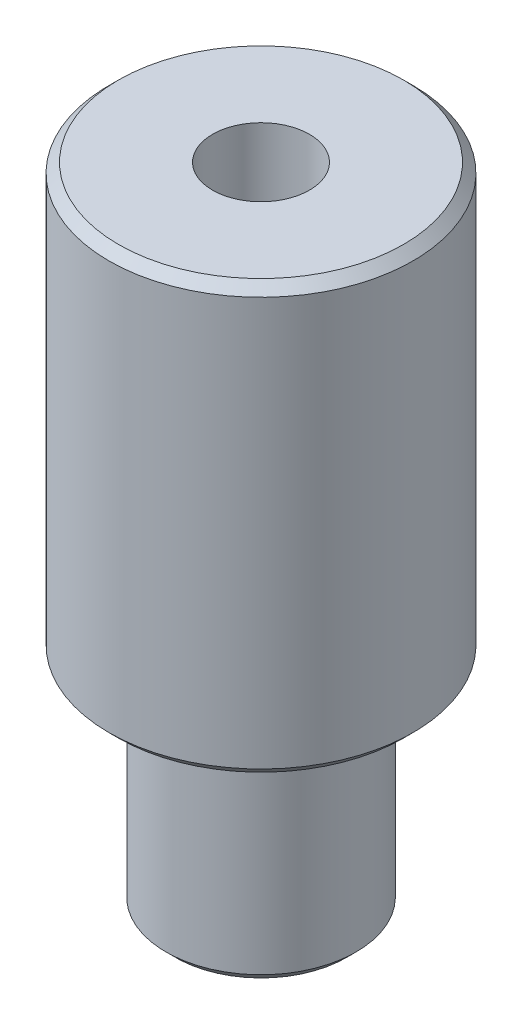
from build123d import *

# Parameters (mm, degrees)
CHAMFER1_SIZE                = 1
F_10_2_10_2_DIAMETER_HOLE1_D = 10.2


with BuildPart() as part:
    # Sketch1 → Revolve1 (revolve)
    with BuildSketch(Plane.XY):
        Polygon((0, 0), (16, 0), (16, -45), (10, -45), (10, -68), (0, -68), align=None)
    revolve(axis=Axis((0, -73, 0), (0, 1, 0)))

    # Chamfer1
    chamfer1_edges = [part.edges().sort_by_distance(p)[0] for p in [
        (-10, -68, 0),
        (-16, -45, 0),
        (-16, 0, 0),
    ]]
    chamfer(chamfer1_edges, length=CHAMFER1_SIZE)

    # Ø10.2 (10.2) Diameter Hole1 (through all)
    with Locations(Plane(origin=(0, 0, 0), x_dir=(1, 0, 0), z_dir=(0, 1, 0))):
        with Locations((0, 0)):
            Hole(F_10_2_10_2_DIAMETER_HOLE1_D / 2)


solid = part.part
